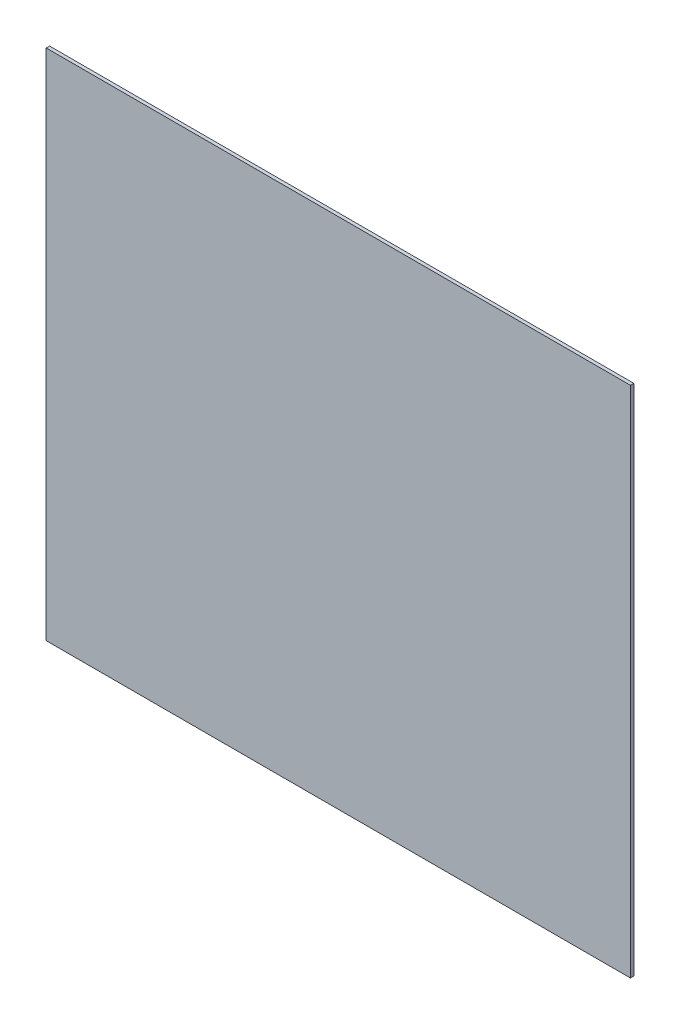
from build123d import *

# Parameters (mm, degrees)
SKETCH1_3_W         = 346
SKETCH1_3_H         = 304
BOSS_EXTRUDE2_DEPTH = 2


with BuildPart() as part:
    # Sketch1<3> → Boss-Extrude2 (new body)
    with BuildSketch(Plane.XY):
        with Locations((3, 0)):
            Rectangle(SKETCH1_3_W, SKETCH1_3_H)
    extrude(amount=BOSS_EXTRUDE2_DEPTH)


solid = part.part
